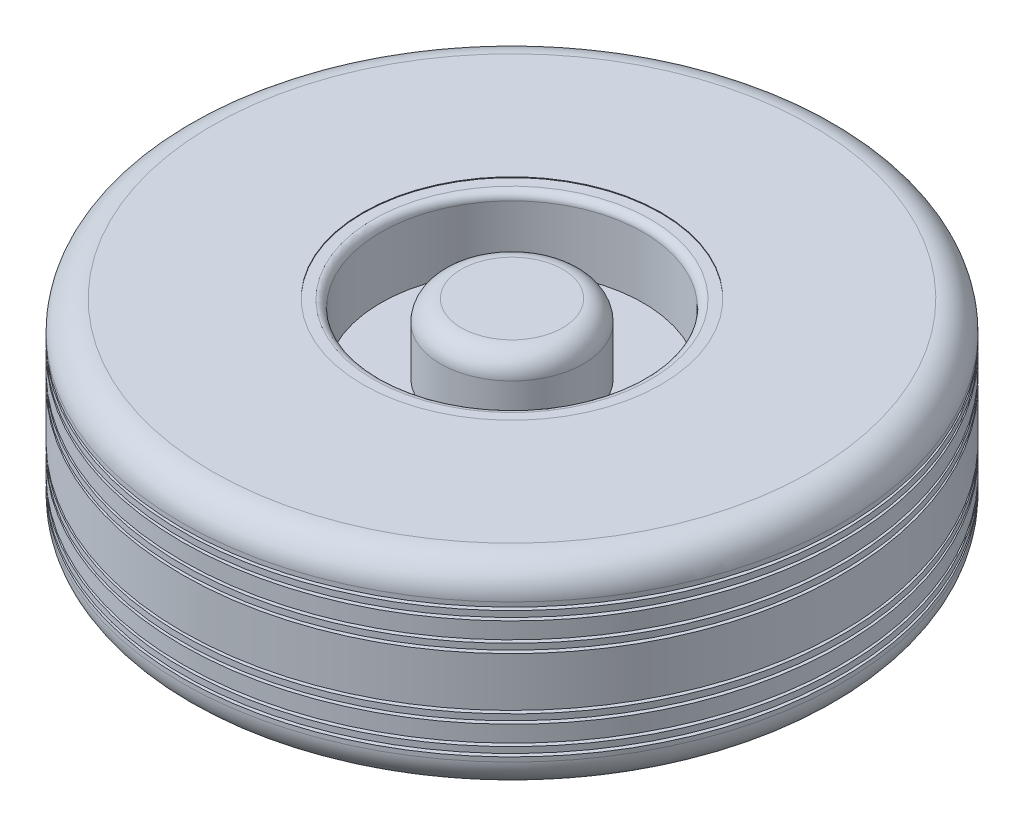
from build123d import *

# Parameters (mm, degrees)
BOSS_EXTRUDE1_DEPTH              = 84.455
BOSS_EXTRUDE1_DEPTH_BACK         = 84.455
SKETCH1_R                        = 280.67
SKETCH1_R_2                      = 127
CUT_REVOLVE_THIN1_START          = -55.245
CUT_REVOLVE_THIN1_OUTLINE_R      = 280.67
CUT_REVOLVE_THIN1_OUTLINE_R_2    = 266.7
CUT_REVOLVE_THIN1_DEPTH          = 2.54
CUT_REVOLVE_THIN1_START_2        = -47.625
CUT_REVOLVE_THIN1_2_OUTLINE_R    = 280.67
CUT_REVOLVE_THIN1_2_OUTLINE_R_2  = 266.7
CUT_REVOLVE_THIN1_2_DEPTH        = 2.54
CUT_REVOLVE_THIN1_START_3        = -31.115
CUT_REVOLVE_THIN1_3_OUTLINE_R    = 280.67
CUT_REVOLVE_THIN1_3_OUTLINE_R_2  = 266.7
CUT_REVOLVE_THIN1_3_DEPTH        = 2.54
CUT_REVOLVE_THIN1_START_4        = -23.495
CUT_REVOLVE_THIN1_4_OUTLINE_R    = 280.67
CUT_REVOLVE_THIN1_4_OUTLINE_R_2  = 266.7
CUT_REVOLVE_THIN1_4_DEPTH        = 2.54
CUT_REVOLVE_THIN1_START_5        = 20.955
CUT_REVOLVE_THIN1_5_OUTLINE_R    = 280.67
CUT_REVOLVE_THIN1_5_OUTLINE_R_2  = 266.7
CUT_REVOLVE_THIN1_5_DEPTH        = 2.54
CUT_REVOLVE_THIN1_START_6        = 28.575
CUT_REVOLVE_THIN1_6_OUTLINE_R    = 280.67
CUT_REVOLVE_THIN1_6_OUTLINE_R_2  = 266.7
CUT_REVOLVE_THIN1_6_DEPTH        = 2.54
CUT_REVOLVE_THIN1_START_7        = 45.085
CUT_REVOLVE_THIN1_7_OUTLINE_R    = 280.67
CUT_REVOLVE_THIN1_7_OUTLINE_R_2  = 266.7
CUT_REVOLVE_THIN1_7_DEPTH        = 2.54
CUT_REVOLVE_THIN1_START_8        = 52.705
CUT_REVOLVE_THIN1_8_OUTLINE_R    = 280.67
CUT_REVOLVE_THIN1_8_OUTLINE_R_2  = 266.7
CUT_REVOLVE_THIN1_8_DEPTH        = 2.54
CUT_REVOLVE_THIN1_START_9        = -52.705
CUT_REVOLVE_THIN1_9_OUTLINE_R    = 269.24
CUT_REVOLVE_THIN1_9_OUTLINE_R_2  = 266.7
CUT_REVOLVE_THIN1_9_DEPTH        = 5.08
CUT_REVOLVE_THIN1_START_10       = -28.575
CUT_REVOLVE_THIN1_10_OUTLINE_R   = 269.24
CUT_REVOLVE_THIN1_10_OUTLINE_R_2 = 266.7
CUT_REVOLVE_THIN1_10_DEPTH       = 5.08
CUT_REVOLVE_THIN1_START_11       = 23.495
CUT_REVOLVE_THIN1_11_OUTLINE_R   = 269.24
CUT_REVOLVE_THIN1_11_OUTLINE_R_2 = 266.7
CUT_REVOLVE_THIN1_11_DEPTH       = 5.08
CUT_REVOLVE_THIN1_START_12       = 47.625
CUT_REVOLVE_THIN1_12_OUTLINE_R   = 269.24
CUT_REVOLVE_THIN1_12_OUTLINE_R_2 = 266.7
CUT_REVOLVE_THIN1_12_DEPTH       = 5.08
FILLET1_R                        = 25.4
BOSS_EXTRUDE3_DEPTH              = 84.455
BOSS_EXTRUDE3_DEPTH_BACK         = 84.455
SKETCH4_R                        = 60.96
BOSS_EXTRUDE4_DEPTH              = 25.4
BOSS_EXTRUDE4_DEPTH_BACK         = 25.4
SKETCH4_5_R                      = 111.76
SKETCH4_5_R_2                    = 60.96
FILLET2_R                        = 17.78
BOSS_EXTRUDE5_DEPTH              = 83.82
BOSS_EXTRUDE5_DEPTH_BACK         = 83.82
SKETCH4_6_R                      = 127
SKETCH4_6_R_2                    = 111.76
FILLET3_R                        = 6.35


# Read off the part's stored shape, not the designer's step: Cut-Revolve-Thin1
with BuildPart() as part:
    # Sketch1 → Boss-Extrude1 (new, two sides: drawn at the far end of the back side and taken through both)
    with BuildSketch(Plane(origin=(0, 0, 0), x_dir=(1, 0, 0), z_dir=(0, 1, 0)).offset(-BOSS_EXTRUDE1_DEPTH_BACK)):
        with Locations(Location((0, 0, 0), (0, 0, 270))):
            Circle(SKETCH1_R)
        with Locations(Location((0, 0, 0), (0, 0, 270))):
            Circle(SKETCH1_R_2, mode=Mode.SUBTRACT)
    extrude(amount=BOSS_EXTRUDE1_DEPTH + BOSS_EXTRUDE1_DEPTH_BACK)

    # Cut-Revolve-Thin1 outline → Cut-Revolve-Thin1 (cut)
    with BuildSketch(Plane(origin=(0, 0, 0), x_dir=(1, 0, 0), z_dir=(0, 1, 0)).offset(CUT_REVOLVE_THIN1_START)):
        Circle(CUT_REVOLVE_THIN1_OUTLINE_R)
        Circle(CUT_REVOLVE_THIN1_OUTLINE_R_2, mode=Mode.SUBTRACT)
    extrude(amount=CUT_REVOLVE_THIN1_DEPTH, mode=Mode.SUBTRACT)

    # Cut-Revolve-Thin1 2 outline → Cut-Revolve-Thin1 2 (cut)
    with BuildSketch(Plane(origin=(0, 0, 0), x_dir=(1, 0, 0), z_dir=(0, 1, 0)).offset(CUT_REVOLVE_THIN1_START_2)):
        Circle(CUT_REVOLVE_THIN1_2_OUTLINE_R)
        Circle(CUT_REVOLVE_THIN1_2_OUTLINE_R_2, mode=Mode.SUBTRACT)
    extrude(amount=CUT_REVOLVE_THIN1_2_DEPTH, mode=Mode.SUBTRACT)

    # Cut-Revolve-Thin1 3 outline → Cut-Revolve-Thin1 3 (cut)
    with BuildSketch(Plane(origin=(0, 0, 0), x_dir=(1, 0, 0), z_dir=(0, 1, 0)).offset(CUT_REVOLVE_THIN1_START_3)):
        Circle(CUT_REVOLVE_THIN1_3_OUTLINE_R)
        Circle(CUT_REVOLVE_THIN1_3_OUTLINE_R_2, mode=Mode.SUBTRACT)
    extrude(amount=CUT_REVOLVE_THIN1_3_DEPTH, mode=Mode.SUBTRACT)

    # Cut-Revolve-Thin1 4 outline → Cut-Revolve-Thin1 4 (cut)
    with BuildSketch(Plane(origin=(0, 0, 0), x_dir=(1, 0, 0), z_dir=(0, 1, 0)).offset(CUT_REVOLVE_THIN1_START_4)):
        Circle(CUT_REVOLVE_THIN1_4_OUTLINE_R)
        Circle(CUT_REVOLVE_THIN1_4_OUTLINE_R_2, mode=Mode.SUBTRACT)
    extrude(amount=CUT_REVOLVE_THIN1_4_DEPTH, mode=Mode.SUBTRACT)

    # Cut-Revolve-Thin1 5 outline → Cut-Revolve-Thin1 5 (cut)
    with BuildSketch(Plane(origin=(0, 0, 0), x_dir=(1, 0, 0), z_dir=(0, 1, 0)).offset(CUT_REVOLVE_THIN1_START_5)):
        Circle(CUT_REVOLVE_THIN1_5_OUTLINE_R)
        Circle(CUT_REVOLVE_THIN1_5_OUTLINE_R_2, mode=Mode.SUBTRACT)
    extrude(amount=CUT_REVOLVE_THIN1_5_DEPTH, mode=Mode.SUBTRACT)

    # Cut-Revolve-Thin1 6 outline → Cut-Revolve-Thin1 6 (cut)
    with BuildSketch(Plane(origin=(0, 0, 0), x_dir=(1, 0, 0), z_dir=(0, 1, 0)).offset(CUT_REVOLVE_THIN1_START_6)):
        Circle(CUT_REVOLVE_THIN1_6_OUTLINE_R)
        Circle(CUT_REVOLVE_THIN1_6_OUTLINE_R_2, mode=Mode.SUBTRACT)
    extrude(amount=CUT_REVOLVE_THIN1_6_DEPTH, mode=Mode.SUBTRACT)

    # Cut-Revolve-Thin1 7 outline → Cut-Revolve-Thin1 7 (cut)
    with BuildSketch(Plane(origin=(0, 0, 0), x_dir=(1, 0, 0), z_dir=(0, 1, 0)).offset(CUT_REVOLVE_THIN1_START_7)):
        Circle(CUT_REVOLVE_THIN1_7_OUTLINE_R)
        Circle(CUT_REVOLVE_THIN1_7_OUTLINE_R_2, mode=Mode.SUBTRACT)
    extrude(amount=CUT_REVOLVE_THIN1_7_DEPTH, mode=Mode.SUBTRACT)

    # Cut-Revolve-Thin1 8 outline → Cut-Revolve-Thin1 8 (cut)
    with BuildSketch(Plane(origin=(0, 0, 0), x_dir=(1, 0, 0), z_dir=(0, 1, 0)).offset(CUT_REVOLVE_THIN1_START_8)):
        Circle(CUT_REVOLVE_THIN1_8_OUTLINE_R)
        Circle(CUT_REVOLVE_THIN1_8_OUTLINE_R_2, mode=Mode.SUBTRACT)
    extrude(amount=CUT_REVOLVE_THIN1_8_DEPTH, mode=Mode.SUBTRACT)

    # Cut-Revolve-Thin1 9 outline → Cut-Revolve-Thin1 9 (cut)
    with BuildSketch(Plane(origin=(0, 0, 0), x_dir=(1, 0, 0), z_dir=(0, 1, 0)).offset(CUT_REVOLVE_THIN1_START_9)):
        Circle(CUT_REVOLVE_THIN1_9_OUTLINE_R)
        Circle(CUT_REVOLVE_THIN1_9_OUTLINE_R_2, mode=Mode.SUBTRACT)
    extrude(amount=CUT_REVOLVE_THIN1_9_DEPTH, mode=Mode.SUBTRACT)

    # Cut-Revolve-Thin1 10 outline → Cut-Revolve-Thin1 10 (cut)
    with BuildSketch(Plane(origin=(0, 0, 0), x_dir=(1, 0, 0), z_dir=(0, 1, 0)).offset(CUT_REVOLVE_THIN1_START_10)):
        Circle(CUT_REVOLVE_THIN1_10_OUTLINE_R)
        Circle(CUT_REVOLVE_THIN1_10_OUTLINE_R_2, mode=Mode.SUBTRACT)
    extrude(amount=CUT_REVOLVE_THIN1_10_DEPTH, mode=Mode.SUBTRACT)

    # Cut-Revolve-Thin1 11 outline → Cut-Revolve-Thin1 11 (cut)
    with BuildSketch(Plane(origin=(0, 0, 0), x_dir=(1, 0, 0), z_dir=(0, 1, 0)).offset(CUT_REVOLVE_THIN1_START_11)):
        Circle(CUT_REVOLVE_THIN1_11_OUTLINE_R)
        Circle(CUT_REVOLVE_THIN1_11_OUTLINE_R_2, mode=Mode.SUBTRACT)
    extrude(amount=CUT_REVOLVE_THIN1_11_DEPTH, mode=Mode.SUBTRACT)

    # Cut-Revolve-Thin1 12 outline → Cut-Revolve-Thin1 12 (cut)
    with BuildSketch(Plane(origin=(0, 0, 0), x_dir=(1, 0, 0), z_dir=(0, 1, 0)).offset(CUT_REVOLVE_THIN1_START_12)):
        Circle(CUT_REVOLVE_THIN1_12_OUTLINE_R)
        Circle(CUT_REVOLVE_THIN1_12_OUTLINE_R_2, mode=Mode.SUBTRACT)
    extrude(amount=CUT_REVOLVE_THIN1_12_DEPTH, mode=Mode.SUBTRACT)

    # Fillet1
    fillet1_edges = [part.edges().sort_by_distance(p)[0] for p in [
        (0, -84.455, -280.67),
        (0, 84.455, -280.67),
    ]]
    fillet(fillet1_edges, radius=FILLET1_R)



with BuildPart() as body_2:
    # Sketch4 → Boss-Extrude3 (new, two sides: drawn at the far end of the back side and taken through both)
    with BuildSketch(Plane(origin=(0, 0, 0), x_dir=(1, 0, 0), z_dir=(0, 1, 0)).offset(-BOSS_EXTRUDE3_DEPTH_BACK)):
        with Locations(Location((0, 0, 0), (0, 0, 270))):
            Circle(SKETCH4_R)
    extrude(amount=BOSS_EXTRUDE3_DEPTH + BOSS_EXTRUDE3_DEPTH_BACK)

    # Sketch4<5> → Boss-Extrude4 (add, two sides: drawn at the far end of the back side and taken through both)
    with BuildSketch(Plane(origin=(0, 0, 0), x_dir=(1, 0, 0), z_dir=(0, 1, 0)).offset(-BOSS_EXTRUDE4_DEPTH_BACK)):
        with Locations(Location((0, 0, 0), (0, 0, 270))):
            Circle(SKETCH4_5_R)
        with Locations(Location((0, 0, 0), (0, 0, 270))):
            Circle(SKETCH4_5_R_2, mode=Mode.SUBTRACT)
    extrude(amount=BOSS_EXTRUDE4_DEPTH + BOSS_EXTRUDE4_DEPTH_BACK)

    # Fillet2
    fillet2_edges = [body_2.edges().sort_by_distance(p)[0] for p in [
        (0, 84.455, -60.96),
        (0, -84.455, -60.96),
    ]]
    fillet(fillet2_edges, radius=FILLET2_R)


with BuildPart() as part_1:
    add(part.part)

    add(body_2.part)  # Boss-Extrude5 merges body 2
    # Sketch4<6> → Boss-Extrude5 (add, two sides: drawn at the far end of the back side and taken through both)
    with BuildSketch(Plane(origin=(0, 0, 0), x_dir=(1, 0, 0), z_dir=(0, 1, 0)).offset(-BOSS_EXTRUDE5_DEPTH_BACK)):
        with Locations(Location((0, 0, 0), (0, 0, 270))):
            Circle(SKETCH4_6_R)
        with Locations(Location((0, 0, 0), (0, 0, 270))):
            Circle(SKETCH4_6_R_2, mode=Mode.SUBTRACT)
    extrude(amount=BOSS_EXTRUDE5_DEPTH + BOSS_EXTRUDE5_DEPTH_BACK)

    # Fillet3
    fillet3_edges = [part_1.edges().sort_by_distance(p)[0] for p in [
        (0, 83.82, -111.76),
    ]]
    fillet(fillet3_edges, radius=FILLET3_R)


solid = part_1.part
